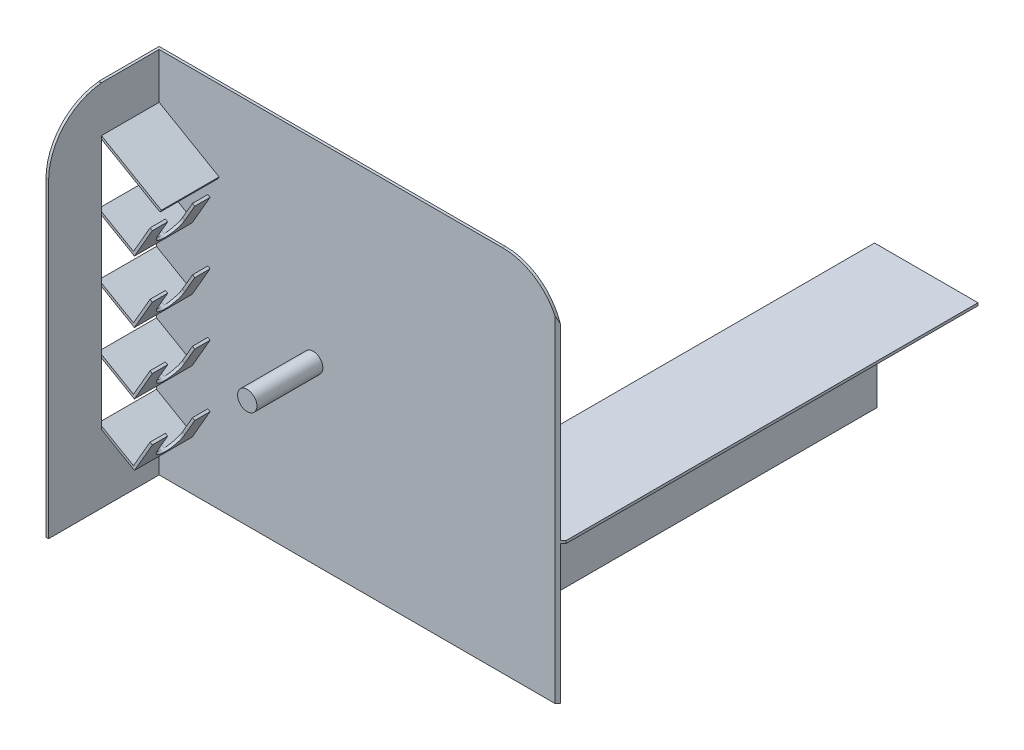
from build123d import *

# Parameters (mm, degrees)
BOSS_EXTRUDE1_START   = 505
SKETCH1_W             = 490
SKETCH1_H             = 446.8
BOSS_EXTRUDE1_DEPTH   = 3.175
FILLET1_R             = 70
EXTRUDE_THIN1_DEPTH   = 70
CUT_EXTRUDE1_DEPTH    = 10
LPATTERN1_COUNT       = 4
LPATTERN1_PITCH       = 75
SKETCH4_R             = 11.713829312
BOSS_EXTRUDE2_DEPTH   = 80
EXTRUDE_THIN3_DEPTH   = 70
EXTRUDE_THIN4_START   = -225
EXTRUDE_THIN4_DEPTH   = 3.175
EXTRUDE_THIN5_DEPTH   = 502.84
SURFACECUT4_START     = 541.993470427
SURFACECUT4_OUTLINE_W = 12
SURFACECUT4_OUTLINE_H = 409
SURFACECUT4_DEPTH     = 4.723815117


# Read off the part's stored shape, not the designer's step: Extrude-Thin3, Extrude-Thin4, SurfaceCut4
with BuildPart() as part:
    # Sketch1 → Boss-Extrude1 (new body)
    with BuildSketch(Plane.XY.offset(BOSS_EXTRUDE1_START)):
        with Locations((20, 226.6)):
            Rectangle(SKETCH1_W, SKETCH1_H)
    extrude(amount=BOSS_EXTRUDE1_DEPTH)

    # Fillet1
    fillet1_edges = [part.edges().sort_by_distance(p)[0] for p in [
        (265, 450, 506.5875),
    ]]
    fillet(fillet1_edges, radius=FILLET1_R)

    # Sketch2 → Extrude-Thin1 (add)
    with BuildSketch(Plane.XY.offset(508.175)):
        Polygon((-225, 316.632001972), (-182.911143749, 292.331989485), (-162.795993223, 327.172452198), (-160.046362566, 325.584952198), (-181.749013092, 287.994858828), (-226.5875, 313.882371315), align=None)
    extrude_thin1 = extrude(amount=EXTRUDE_THIN1_DEPTH)

    # Sketch3 → Cut-Extrude1 (cut)
    with BuildSketch(Plane(origin=(-261.017191771, 150.698345932, 0), x_dir=(0, 0, -1), z_dir=(0.86602540378444, -0.49999999999999756, 0))):
        with BuildLine():
            Line((-526.749692135, 201.941658411), (-526.749692135, 177.989368438))
            ThreePointArc((-526.749692135, 177.989368438), (-543.175, 161.564060573), (-559.600307865, 177.989368438))
            Line((-559.600307865, 177.989368438), (-559.600307865, 201.941658411))
            ThreePointArc((-559.600307865, 201.941658411), (-543.175, 218.366966275), (-526.749692135, 201.941658411))
        make_face()
    cut_extrude1 = extrude(amount=-CUT_EXTRUDE1_DEPTH, mode=Mode.SUBTRACT)

    # LPattern1: Extrude-Thin1, Cut-Extrude1 ×4
    with Locations(*[(0, -i * LPATTERN1_PITCH, 0) for i in range(1, LPATTERN1_COUNT)]):
        add(extrude_thin1)
        add(cut_extrude1, mode=Mode.SUBTRACT)

    # Sketch4 → Boss-Extrude2 (add)
    with BuildSketch(Plane.XY.offset(508.175)):
        with Locations((-35.00971575, 214.777573056)):
            Circle(SKETCH4_R)
    extrude(amount=BOSS_EXTRUDE2_DEPTH)

    # Extrude-Thin3 outline → Extrude-Thin3 (add)
    with BuildSketch(Plane.XY.offset(508.175)):
        Polygon((-225, 450), (-225, 392.649743917), (-150.706309563, 349.756261744), (-149.118809563, 352.505892401), (-221.825, 394.482831022), (-221.825, 450), align=None)
        Polygon((-225, 87.965827762), (-225, 3.2), (-221.825, 3.2), (-221.825, 86.132740658), align=None)
    extrude(amount=EXTRUDE_THIN3_DEPTH)

    # Extrude-Thin4 outline → Extrude-Thin4 (add)
    with BuildSketch(Plane.YZ.offset(EXTRUDE_THIN4_START)):
        with BuildLine():
            Line((3.2, 578.175), (449.741091008, 578.175))
            ThreePointArc((449.741091008, 578.175), (427.323091613, 623.740277235), (380, 642.159999995))
            Line((380, 642.159999995), (3.2, 642.159999995))
            Line((3.2, 642.159999995), (3.2, 578.175))
        make_face()
    extrude(amount=EXTRUDE_THIN4_DEPTH)

    # Sketch8 → Extrude-Thin5 (add)
    with BuildSketch(Plane(origin=(0, 0, 505), x_dir=(-1, 0, 0), z_dir=(0, 0, -1))):
        Polygon((-142.726543885, 3.2), (-142.726543885, 171.264978509), (-265, 171.264978509), (-265, 174.439978509), (-139.551543885, 174.439978509), (-139.551543885, 3.2), align=None)
    extrude(amount=EXTRUDE_THIN5_DEPTH)

    # SurfaceCut4 outline → SurfaceCut4 (cut)
    with BuildSketch(Plane(origin=(0, 0, 0), x_dir=(0.707106781186548, 0, -0.707106781186547), z_dir=(0.707106781186547, 0, 0.707106781186548)).offset(SURFACECUT4_START)):
        with Locations((-172, 206.5)):
            Rectangle(SURFACECUT4_OUTLINE_W, SURFACECUT4_OUTLINE_H)
    extrude(amount=SURFACECUT4_DEPTH, mode=Mode.SUBTRACT)


solid = part.part
